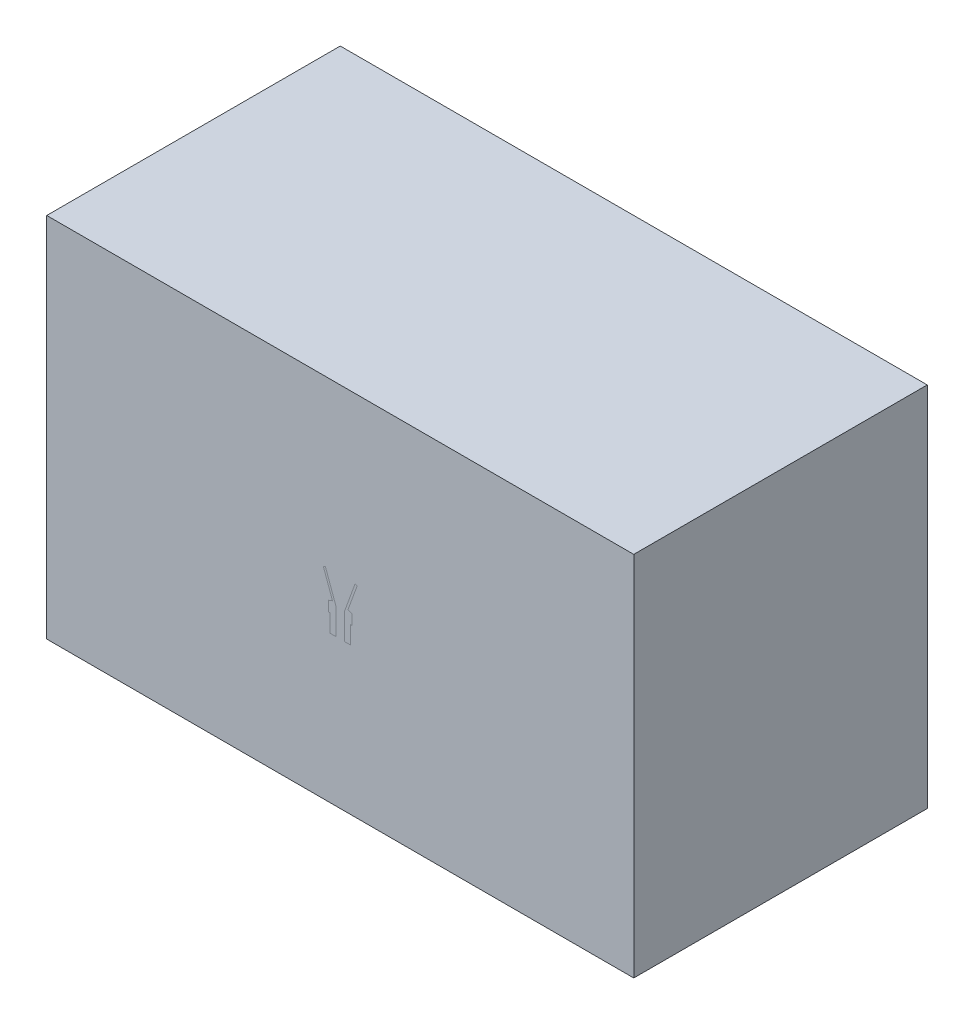
from build123d import *

# Parameters (mm, degrees)
SKETCH1_R           = 175
SKETCH1_R_2         = 75
BOSS_EXTRUDE1_DEPTH = 457
SKETCH3_W           = 10160
SKETCH3_H           = 6350
BOSS_EXTRUDE2_DEPTH = 5080
SKETCH4_W           = 13475.768327993
SKETCH4_H           = 8367.586519284
CUT_EXTRUDE1_DEPTH  = 8132.96778154


with BuildPart() as part:
    # Sketch1 → Boss-Extrude1 (new body)
    with BuildSketch(Plane(origin=(0, 0, 0), x_dir=(1, 0, 0), z_dir=(0, 1, 0))):
        with Locations(Location((0, 0, 0), (0, 0, 270))):
            Circle(SKETCH1_R)
        with Locations(Location((0, 0, 0), (0, 0, 270))):
            Circle(SKETCH1_R_2, mode=Mode.SUBTRACT)
    extrude(amount=BOSS_EXTRUDE1_DEPTH)

    # Sketch2 → Revolve1 (revolve)
    with BuildSketch(Plane.XY, mode=Mode.PRIVATE) as revolve1_sk:
        Polygon((-175, 307), (-200.4, 307), (-200.4, 482.4), (-133.634704911, 506.700580094), (-293.235833302, 945.201076466), (-257.43354445, 958.232043927), (-101.061934921, 528.604577704), (-75, 457), (-175, 457), align=None)
    revolve(revolve1_sk.sketch.rotate(Axis((0, 0, 0), (0, 1, 0)), 270), axis=Axis((0, 0, 0), (0, 1, 0)))


with BuildPart() as body_2:
    # Sketch3 → Boss-Extrude2 (new, symmetric)
    with BuildSketch(Plane(origin=(0, 0, 0), x_dir=(0, 0, -1), z_dir=(1, 0, 0))):
        with Locations((0, 635)):
            Rectangle(SKETCH3_W, SKETCH3_H)
    extrude(amount=BOSS_EXTRUDE2_DEPTH, both=True)

    # Intersect1: read off the stored shape, not the designer's step
    # Intersect1 outline → Intersect1 (revolve, cut)
    with BuildSketch(Plane.XY):
        Polygon((75, 457), (75, 0), (175, 0), (175, 307), (200.4, 307), (200.4, 482.4), (133.634704911, 506.700580094), (293.235833302, 945.201076466), (257.43354445, 958.232043927), align=None)
    revolve(axis=Axis((0, 0, 0), (0, 1, 0)), mode=Mode.SUBTRACT)


with BuildPart() as cut_extrude1_tool:
    # Sketch4 → Cut-Extrude1 (new, through all)
    with BuildSketch(Plane.XY):
        with Locations((454.179344916, 464.014834855)):
            Rectangle(SKETCH4_W, SKETCH4_H)
    extrude(amount=CUT_EXTRUDE1_DEPTH)


with BuildPart() as part_1:
    add(part.part)

    # Cut-Extrude1: cut by cut_extrude1_tool
    add(cut_extrude1_tool.part, mode=Mode.SUBTRACT)


with BuildPart() as body_2_1:
    add(body_2.part)

    # Cut-Extrude1: cut by cut_extrude1_tool
    add(cut_extrude1_tool.part, mode=Mode.SUBTRACT)


solid = Compound([part_1.part, body_2_1.part])
